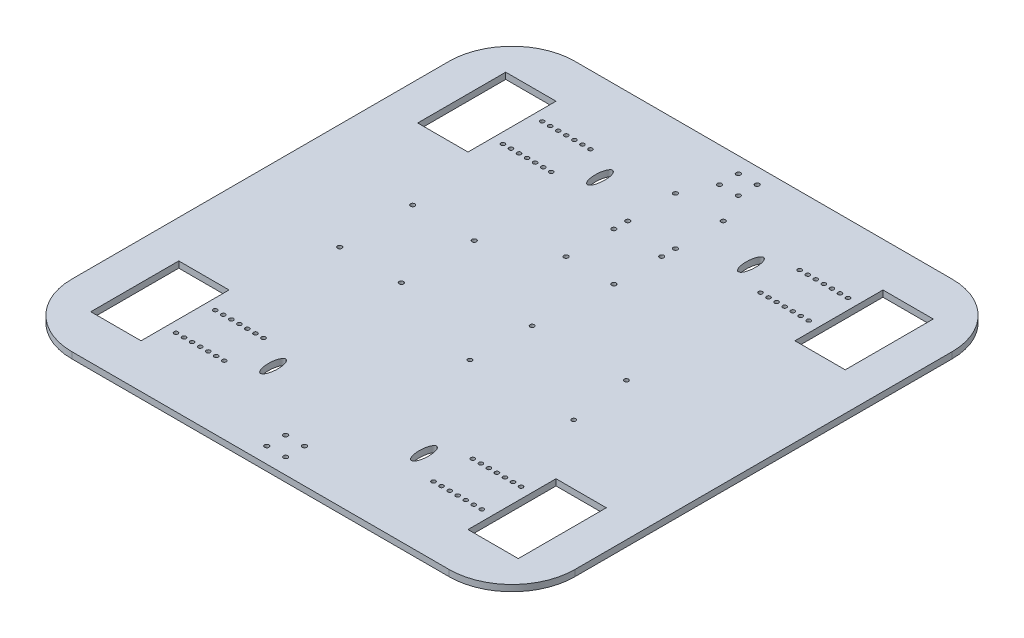
from build123d import *

# Parameters (mm, degrees)
SKETCH1_W           = 400
SKETCH1_H           = 400
SKETCH1_R           = 1.75
SKETCH1_W_2         = 40
SKETCH1_H_2         = 70
BOSS_EXTRUDE2_DEPTH = 5
FILLET1_R           = 50
SKETCH2_R           = 1.6
CUT_EXTRUDE1_DEPTH  = 5
SKETCH3_R           = 1.65
CUT_EXTRUDE2_DEPTH  = 10
SKETCH4_R           = 1.75
CUT_EXTRUDE3_DEPTH  = 10
SKETCH5_R           = 1.75
CUT_EXTRUDE4_DEPTH  = 10
SKETCH6_RX          = 10
SKETCH6_RY          = 3.75
CUT_EXTRUDE5_DEPTH  = 10


with BuildPart() as part:
    # Sketch1 → Boss-Extrude2 (new body)
    with BuildSketch(Plane(origin=(0, 0, 0), x_dir=(1, 0, 0), z_dir=(0, 1, 0))):
        Rectangle(SKETCH1_W, SKETCH1_H)
        with Locations((-7.5, 172.5)):
            Circle(SKETCH1_R, mode=Mode.SUBTRACT)
        with Locations((-7.5, 187.5)):
            Circle(SKETCH1_R, mode=Mode.SUBTRACT)
        with Locations((7.5, 172.5)):
            Circle(SKETCH1_R, mode=Mode.SUBTRACT)
        with Locations((7.5, 187.5)):
            Circle(SKETCH1_R, mode=Mode.SUBTRACT)
        with Locations((-150, -130)):
            Rectangle(SKETCH1_W_2, SKETCH1_H_2, mode=Mode.SUBTRACT)
        with Locations((150, -130)):
            Rectangle(SKETCH1_W_2, SKETCH1_H_2, mode=Mode.SUBTRACT)
        with Locations((-150, 130)):
            Rectangle(SKETCH1_W_2, SKETCH1_H_2, mode=Mode.SUBTRACT)
        with Locations((150, 130)):
            Rectangle(SKETCH1_W_2, SKETCH1_H_2, mode=Mode.SUBTRACT)
        with Locations((-7.5, -187.5)):
            Circle(SKETCH1_R, mode=Mode.SUBTRACT)
        with Locations((-7.5, -172.5)):
            Circle(SKETCH1_R, mode=Mode.SUBTRACT)
        with Locations((7.5, -187.5)):
            Circle(SKETCH1_R, mode=Mode.SUBTRACT)
        with Locations((7.5, -172.5)):
            Circle(SKETCH1_R, mode=Mode.SUBTRACT)
    extrude(amount=BOSS_EXTRUDE2_DEPTH)

    # Fillet1
    fillet1_edges = [part.edges().sort_by_distance(p)[0] for p in [
        (200, 2.5, -200),
        (200, 2.5, 200),
        (-200, 2.5, 200),
        (-200, 2.5, -200),
    ]]
    fillet(fillet1_edges, radius=FILLET1_R)

    # Sketch2 → Cut-Extrude1 (cut)
    with BuildSketch(Plane(origin=(0, 5, 0), x_dir=(1, 0, 0), z_dir=(0, 1, 0))):
        with Locations((-121.6, 145.6)):
            Circle(SKETCH2_R)
        with Locations((-115.2, 145.6)):
            Circle(SKETCH2_R)
        with Locations((-108.8, 145.6)):
            Circle(SKETCH2_R)
        with Locations((-102.4, 145.6)):
            Circle(SKETCH2_R)
        with Locations((-96, 145.6)):
            Circle(SKETCH2_R)
        with Locations((-89.6, 145.6)):
            Circle(SKETCH2_R)
        with Locations((-83.2, 145.6)):
            Circle(SKETCH2_R)
        with Locations((-83.2, 114.4)):
            Circle(SKETCH2_R)
        with Locations((-89.6, 114.4)):
            Circle(SKETCH2_R)
        with Locations((-96, 114.4)):
            Circle(SKETCH2_R)
        with Locations((-102.4, 114.4)):
            Circle(SKETCH2_R)
        with Locations((-108.8, 114.4)):
            Circle(SKETCH2_R)
        with Locations((-115.2, 114.4)):
            Circle(SKETCH2_R)
        with Locations((-121.6, 114.4)):
            Circle(SKETCH2_R)
        with Locations((83.2, 114.4)):
            Circle(SKETCH2_R)
        with Locations((89.6, 114.4)):
            Circle(SKETCH2_R)
        with Locations((96, 114.4)):
            Circle(SKETCH2_R)
        with Locations((102.4, 114.4)):
            Circle(SKETCH2_R)
        with Locations((108.8, 114.4)):
            Circle(SKETCH2_R)
        with Locations((115.2, 114.4)):
            Circle(SKETCH2_R)
        with Locations((121.6, 114.4)):
            Circle(SKETCH2_R)
        with Locations((83.2, 145.6)):
            Circle(SKETCH2_R)
        with Locations((89.6, 145.6)):
            Circle(SKETCH2_R)
        with Locations((96, 145.6)):
            Circle(SKETCH2_R)
        with Locations((102.4, 145.6)):
            Circle(SKETCH2_R)
        with Locations((108.8, 145.6)):
            Circle(SKETCH2_R)
        with Locations((115.2, 145.6)):
            Circle(SKETCH2_R)
        with Locations((121.6, 145.6)):
            Circle(SKETCH2_R)
        with Locations((121.6, -145.6)):
            Circle(SKETCH2_R)
        with Locations((115.2, -145.6)):
            Circle(SKETCH2_R)
        with Locations((108.8, -145.6)):
            Circle(SKETCH2_R)
        with Locations((102.4, -145.6)):
            Circle(SKETCH2_R)
        with Locations((96, -145.6)):
            Circle(SKETCH2_R)
        with Locations((89.6, -145.6)):
            Circle(SKETCH2_R)
        with Locations((83.2, -145.6)):
            Circle(SKETCH2_R)
        with Locations((121.6, -114.4)):
            Circle(SKETCH2_R)
        with Locations((115.2, -114.4)):
            Circle(SKETCH2_R)
        with Locations((108.8, -114.4)):
            Circle(SKETCH2_R)
        with Locations((102.4, -114.4)):
            Circle(SKETCH2_R)
        with Locations((96, -114.4)):
            Circle(SKETCH2_R)
        with Locations((89.6, -114.4)):
            Circle(SKETCH2_R)
        with Locations((83.2, -114.4)):
            Circle(SKETCH2_R)
        with Locations((-121.6, -114.4)):
            Circle(SKETCH2_R)
        with Locations((-115.2, -114.4)):
            Circle(SKETCH2_R)
        with Locations((-108.8, -114.4)):
            Circle(SKETCH2_R)
        with Locations((-102.4, -114.4)):
            Circle(SKETCH2_R)
        with Locations((-96, -114.4)):
            Circle(SKETCH2_R)
        with Locations((-89.6, -114.4)):
            Circle(SKETCH2_R)
        with Locations((-83.2, -114.4)):
            Circle(SKETCH2_R)
        with Locations((-83.2, -145.6)):
            Circle(SKETCH2_R)
        with Locations((-89.6, -145.6)):
            Circle(SKETCH2_R)
        with Locations((-96, -145.6)):
            Circle(SKETCH2_R)
        with Locations((-102.4, -145.6)):
            Circle(SKETCH2_R)
        with Locations((-108.8, -145.6)):
            Circle(SKETCH2_R)
        with Locations((-115.2, -145.6)):
            Circle(SKETCH2_R)
        with Locations((-121.6, -145.6)):
            Circle(SKETCH2_R)
    extrude(amount=-CUT_EXTRUDE1_DEPTH, mode=Mode.SUBTRACT)

    # Sketch3 → Cut-Extrude2 (cut)
    with BuildSketch(Plane(origin=(0, 5, 0), x_dir=(1, 0, 0), z_dir=(0, 1, 0))):
        with Locations((13.97, -47.46)):
            Circle(SKETCH3_R)
        with Locations((15.24, 0.8)):
            Circle(SKETCH3_R)
        with Locations((96.52, -47.46)):
            Circle(SKETCH3_R)
        with Locations((90.17, 0.8)):
            Circle(SKETCH3_R)
    extrude(amount=-CUT_EXTRUDE2_DEPTH, mode=Mode.SUBTRACT)

    # Sketch4 → Cut-Extrude3 (cut)
    with BuildSketch(Plane(origin=(0, 5, 0), x_dir=(1, 0, 0), z_dir=(0, 1, 0))):
        with Locations((-19, 149)):
            Circle(SKETCH4_R)
        with Locations((19, 149)):
            Circle(SKETCH4_R)
        with Locations((19, 111)):
            Circle(SKETCH4_R)
        with Locations((-19, 111)):
            Circle(SKETCH4_R)
        with Locations((-19, 100)):
            Circle(SKETCH4_R)
        with Locations((19, 100)):
            Circle(SKETCH4_R)
        with Locations((19, 62)):
            Circle(SKETCH4_R)
        with Locations((-19, 62)):
            Circle(SKETCH4_R)
    extrude(amount=-CUT_EXTRUDE3_DEPTH, mode=Mode.SUBTRACT)

    # Sketch5 → Cut-Extrude4 (cut)
    with BuildSketch(Plane(origin=(0, 5, 0), x_dir=(1, 0, 0), z_dir=(0, 1, 0))):
        with Locations((-115.5, 36.5)):
            Circle(SKETCH5_R)
        with Locations((-66.5, 36.5)):
            Circle(SKETCH5_R)
        with Locations((-66.5, -21.5)):
            Circle(SKETCH5_R)
        with Locations((-115.5, -21.5)):
            Circle(SKETCH5_R)
    extrude(amount=-CUT_EXTRUDE4_DEPTH, mode=Mode.SUBTRACT)

    # Sketch6 → Cut-Extrude5 (cut)
    with BuildSketch(Plane(origin=(0, 5, 0), x_dir=(1, 0, 0), z_dir=(0, 1, 0))):
        with Locations(Location((-60, 130), (0, 0, -90))):
            Ellipse(SKETCH6_RX, SKETCH6_RY)
        with Locations(Location((60, 130), (0, 0, 90))):
            Ellipse(SKETCH6_RX, SKETCH6_RY)
        with Locations(Location((60, -130), (0, 0, -90))):
            Ellipse(SKETCH6_RX, SKETCH6_RY)
        with Locations(Location((-60, -130), (0, 0, -90))):
            Ellipse(SKETCH6_RX, SKETCH6_RY)
    extrude(amount=-CUT_EXTRUDE5_DEPTH, mode=Mode.SUBTRACT)


solid = part.part
